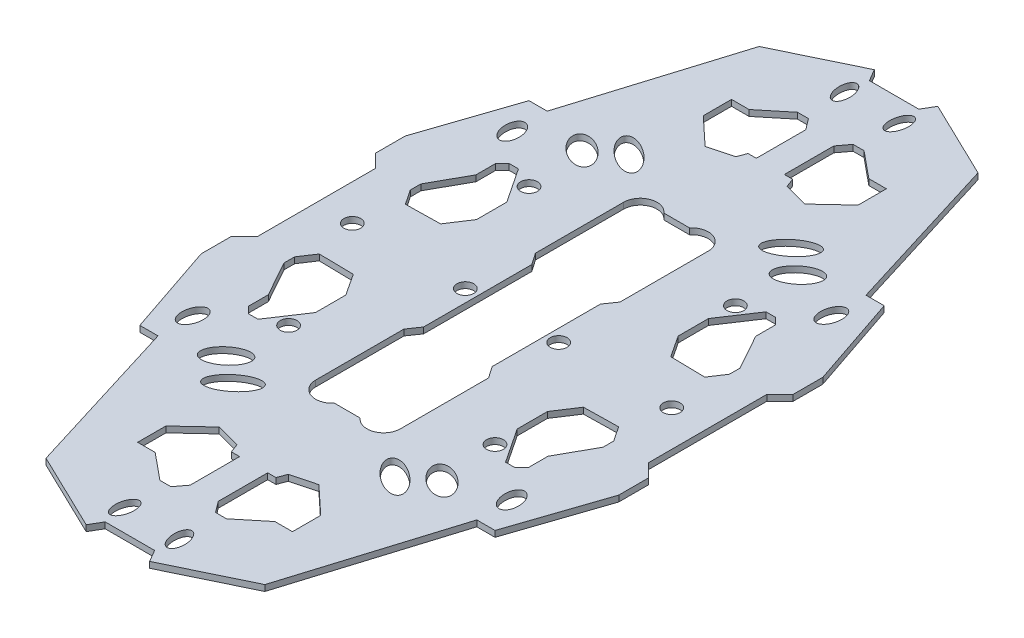
from build123d import *

# Parameters (mm, degrees)
BOSS_EXTRUDE1_DEPTH = 2.5
SKETCH8_R           = 3.5
CUT_EXTRUDE1_DEPTH  = 186.514646793


# Read off the part's stored shape, not the designer's step: Boss-Extrude1
with BuildPart() as part:
    # Boss-Extrude1 outline → Boss-Extrude1 (new body)
    with BuildSketch(Plane(origin=(0, 0, 0), x_dir=(1, 0, 0), z_dir=(0, 1, 0))):
        Polygon((-45.513137952, -148.299430721), (-13.199466787, -163.90034476), (-10.273563929, -158.926309901), (10.273563929, -158.926309901), (13.199466787, -163.90034476), (45.513137952, -148.299430721), (66.29043761, -80.933484761), (73.862243514, -80.933484761), (86.868355064, -42.439555474), (86.868355064, -30.071150974), (81.396454733, -24.599250643), (81.396454733, 24.599250643), (86.868355064, 30.071150974), (86.868355064, 42.439555474), (73.862243514, 80.933484761), (66.29043761, 80.933484761), (45.513137952, 148.299430721), (13.199466787, 163.90034476), (10.273563929, 158.926309901), (-10.273563929, 158.926309901), (-13.199466787, 163.90034476), (-45.513137952, 148.299430721), (-66.29043761, 80.933484761), (-73.862243514, 80.933484761), (-86.868355064, 42.439555474), (-86.868355064, 30.071150974), (-81.396454733, 24.599250643), (-81.396454733, -24.599250643), (-86.868355064, -30.071150974), (-86.868355064, -42.439555474), (-73.862243514, -80.933484761), (-66.29043761, -80.933484761), align=None)
        with BuildLine():
            add(Edge.make_bspline(
                [(-12.055306727, -155.270246002), (-6.888097383, -155.890311123), (-8.466427386, -147.202989655), (-10.044757389, -138.515668187), (-13.63363673, -146.582924534), (-17.222516071, -154.650180881), (-12.055306727, -155.270246002)],
                knots=[0, 0, 0, 2.094395102, 2.094395102, 4.188790205, 4.188790205, 6.283185307, 6.283185307, 6.283185307], degree=2, weights=[1, 0.5, 1, 0.5, 1, 0.5, 1]))
        make_face(mode=Mode.SUBTRACT)
        with BuildLine():
            add(Edge.make_bspline(
                [(-41.109644462, -88.389472789), (-36.381778622, -94.208384592), (-27.619928094, -82.259229639), (-18.858077566, -70.310074686), (-32.347793934, -76.440317836), (-45.837510302, -82.570560986), (-41.109644462, -88.389472789)],
                knots=[0, 0, 0, 2.094395102, 2.094395102, 4.188790205, 4.188790205, 6.283185307, 6.283185307, 6.283185307], degree=2, weights=[1, 0.5, 1, 0.5, 1, 0.5, 1]))
        make_face(mode=Mode.SUBTRACT)
        Polygon((-5.834875923, -107.44522339), (-5.834875923, -128.014628126), (-9.270194242, -132.585606956), (-13.841173073, -132.585606956), (-24.907753398, -123.503793754), (-32.198995676, -123.503793754), (-32.198995676, -111.76010755), (-20.757785776, -101.069910811), (-10.662983723, -103.716266976), (-9.270194242, -107.44522339), align=None, mode=Mode.SUBTRACT)
        with BuildLine():
            add(Edge.make_bspline(
                [(-67.147068225, -72.241634313), (-61.018671546, -73.078762277), (-62.895555816, -63.968179976), (-64.772440086, -54.857597675), (-69.023952495, -63.131052012), (-73.275464904, -71.404506348), (-67.147068225, -72.241634313)],
                knots=[0, 0, 0, 2.094395102, 2.094395102, 4.188790205, 4.188790205, 6.283185307, 6.283185307, 6.283185307], degree=2, weights=[1, 0.5, 1, 0.5, 1, 0.5, 1]))
        make_face(mode=Mode.SUBTRACT)
        with BuildLine():
            add(Edge.make_bspline(
                [(-51.486619053, -79.373952319), (-46.369881131, -85.671475916), (-39.041573506, -74.489789392), (-31.713265882, -63.308102868), (-44.158311429, -68.192265795), (-56.603356975, -73.076428723), (-51.486619053, -79.373952319)],
                knots=[0, 0, 0, 2.094395102, 2.094395102, 4.188790205, 4.188790205, 6.283185307, 6.283185307, 6.283185307], degree=2, weights=[1, 0.5, 1, 0.5, 1, 0.5, 1]))
        make_face(mode=Mode.SUBTRACT)
        Polygon((-47.849651346, -18.166894335), (-41.941351313, -27.187750764), (-41.941351313, -39.789061162), (-51.486619053, -54.160218526), (-55.402714886, -54.160218526), (-58.163676153, -51.399257259), (-58.163676153, -43.187167337), (-66.355525512, -28.46204058), (-66.355525512, -24.072820104), (-62.259600832, -17.90608076), align=None, mode=Mode.SUBTRACT)
        with BuildLine():
            add(Edge.make_bspline(
                [(12.055306727, -155.270246002), (6.888097383, -155.890311123), (8.466427386, -147.202989655), (10.044757389, -138.515668187), (13.63363673, -146.582924534), (17.222516071, -154.650180881), (12.055306727, -155.270246002)],
                knots=[0, 0, 0, 2.094395102, 2.094395102, 4.188790205, 4.188790205, 6.283185307, 6.283185307, 6.283185307], degree=2, weights=[1, 0.5, 1, 0.5, 1, 0.5, 1]))
        make_face(mode=Mode.SUBTRACT)
        Polygon((9.270194242, -132.585606956), (5.834875923, -128.014628126), (5.834875923, -107.44522339), (9.270194242, -107.44522339), (10.662983723, -103.716266976), (20.757785776, -101.069910811), (32.198995676, -111.76010755), (32.198995676, -123.503793754), (24.907753398, -123.503793754), (13.841173073, -132.585606956), align=None, mode=Mode.SUBTRACT)
        with BuildLine():
            add(Edge.make_bspline(
                [(41.109644462, -88.389472789), (36.381778622, -94.208384592), (27.619928094, -82.259229639), (18.858077566, -70.310074686), (32.347793934, -76.440317836), (45.837510302, -82.570560986), (41.109644462, -88.389472789)],
                knots=[0, 0, 0, 2.094395102, 2.094395102, 4.188790205, 4.188790205, 6.283185307, 6.283185307, 6.283185307], degree=2, weights=[1, 0.5, 1, 0.5, 1, 0.5, 1]))
        make_face(mode=Mode.SUBTRACT)
        with BuildLine():
            add(Edge.make_bspline(
                [(51.486619053, -79.373952319), (46.369881131, -85.671475916), (39.041573506, -74.489789392), (31.713265882, -63.308102868), (44.158311429, -68.192265795), (56.603356975, -73.076428723), (51.486619053, -79.373952319)],
                knots=[0, 0, 0, 2.094395102, 2.094395102, 4.188790205, 4.188790205, 6.283185307, 6.283185307, 6.283185307], degree=2, weights=[1, 0.5, 1, 0.5, 1, 0.5, 1]))
        make_face(mode=Mode.SUBTRACT)
        with BuildLine():
            add(Edge.make_bspline(
                [(67.147068225, -72.241634313), (61.018671546, -73.078762277), (62.895555816, -63.968179976), (64.772440086, -54.857597675), (69.023952495, -63.131052012), (73.275464904, -71.404506348), (67.147068225, -72.241634313)],
                knots=[0, 0, 0, 2.094395102, 2.094395102, 4.188790205, 4.188790205, 6.283185307, 6.283185307, 6.283185307], degree=2, weights=[1, 0.5, 1, 0.5, 1, 0.5, 1]))
        make_face(mode=Mode.SUBTRACT)
        Polygon((55.402714886, -54.160218526), (51.486619053, -54.160218526), (41.941351313, -39.789061162), (41.941351313, -27.187750764), (47.849651346, -18.166894335), (62.259600832, -17.90608076), (66.355525512, -24.072820104), (66.355525512, -28.46204058), (58.163676153, -43.187167337), (58.163676153, -51.399257259), align=None, mode=Mode.SUBTRACT)
        Polygon((-55.402714886, 54.160218526), (-51.486619053, 54.160218526), (-41.941351313, 39.789061162), (-41.941351313, 27.187750764), (-47.849651346, 18.166894335), (-62.259600832, 17.90608076), (-66.355525512, 24.072820104), (-66.355525512, 28.46204058), (-58.163676153, 43.187167337), (-58.163676153, 51.399257259), align=None, mode=Mode.SUBTRACT)
        with BuildLine():
            add(Edge.make_bspline(
                [(-67.147068225, 72.241634313), (-61.018671546, 73.078762277), (-62.895555816, 63.968179976), (-64.772440086, 54.857597675), (-69.023952495, 63.131052012), (-73.275464904, 71.404506348), (-67.147068225, 72.241634313)],
                knots=[0, 0, 0, 2.094395102, 2.094395102, 4.188790205, 4.188790205, 6.283185307, 6.283185307, 6.283185307], degree=2, weights=[1, 0.5, 1, 0.5, 1, 0.5, 1]))
        make_face(mode=Mode.SUBTRACT)
        with BuildLine():
            add(Edge.make_bspline(
                [(-51.486619053, 79.373952319), (-46.369881131, 85.671475916), (-39.041573506, 74.489789392), (-31.713265882, 63.308102868), (-44.158311429, 68.192265795), (-56.603356975, 73.076428723), (-51.486619053, 79.373952319)],
                knots=[0, 0, 0, 2.094395102, 2.094395102, 4.188790205, 4.188790205, 6.283185307, 6.283185307, 6.283185307], degree=2, weights=[1, 0.5, 1, 0.5, 1, 0.5, 1]))
        make_face(mode=Mode.SUBTRACT)
        with BuildLine():
            add(Edge.make_bspline(
                [(-41.109644462, 88.389472789), (-36.381778622, 94.208384592), (-27.619928094, 82.259229639), (-18.858077566, 70.310074686), (-32.347793934, 76.440317836), (-45.837510302, 82.570560986), (-41.109644462, 88.389472789)],
                knots=[0, 0, 0, 2.094395102, 2.094395102, 4.188790205, 4.188790205, 6.283185307, 6.283185307, 6.283185307], degree=2, weights=[1, 0.5, 1, 0.5, 1, 0.5, 1]))
        make_face(mode=Mode.SUBTRACT)
        Polygon((-9.270194242, 132.585606956), (-5.834875923, 128.014628126), (-5.834875923, 107.44522339), (-9.270194242, 107.44522339), (-10.662983723, 103.716266976), (-20.757785776, 101.069910811), (-32.198995676, 111.76010755), (-32.198995676, 123.503793754), (-24.907753398, 123.503793754), (-13.841173073, 132.585606956), align=None, mode=Mode.SUBTRACT)
        with BuildLine():
            add(Edge.make_bspline(
                [(-12.055306727, 155.270246002), (-6.888097383, 155.890311123), (-8.466427386, 147.202989655), (-10.044757389, 138.515668187), (-13.63363673, 146.582924534), (-17.222516071, 154.650180881), (-12.055306727, 155.270246002)],
                knots=[0, 0, 0, 2.094395102, 2.094395102, 4.188790205, 4.188790205, 6.283185307, 6.283185307, 6.283185307], degree=2, weights=[1, 0.5, 1, 0.5, 1, 0.5, 1]))
        make_face(mode=Mode.SUBTRACT)
        with BuildLine():
            ThreePointArc((17.600819084, -64.024331642), (13.039673653, -70.554486626), (5.345717729, -68.492930418))
            Line((5.345717729, -68.492930418), (-5.345717729, -68.492930418))
            ThreePointArc((-5.345717729, -68.492930418), (-13.039673653, -70.554486626), (-17.600819084, -64.024331642))
            Line((-17.600819084, -64.024331642), (-17.600819084, -27.344801488))
            Line((-17.600819084, -27.344801488), (-14.264554689, -22.498047837))
            Line((-14.264554689, -22.498047837), (-14.264554689, 22.498047837))
            Line((-14.264554689, 22.498047837), (-17.600819084, 27.344801488))
            Line((-17.600819084, 27.344801488), (-17.600819084, 64.024331642))
            ThreePointArc((-17.600819084, 64.024331642), (-13.039673653, 70.554486626), (-5.345717729, 68.492930418))
            Line((-5.345717729, 68.492930418), (5.345717729, 68.492930418))
            ThreePointArc((5.345717729, 68.492930418), (13.039673653, 70.554486626), (17.600819084, 64.024331642))
            Line((17.600819084, 64.024331642), (17.600819084, 27.344801488))
            Line((17.600819084, 27.344801488), (14.264554689, 22.498047837))
            Line((14.264554689, 22.498047837), (14.264554689, -22.498047837))
            Line((14.264554689, -22.498047837), (17.600819084, -27.344801488))
            Line((17.600819084, -27.344801488), (17.600819084, -64.024331642))
        make_face(mode=Mode.SUBTRACT)
        Polygon((47.849651346, 18.166894335), (41.941351313, 27.187750764), (41.941351313, 39.789061162), (51.486619053, 54.160218526), (55.402714886, 54.160218526), (58.163676153, 51.399257259), (58.163676153, 43.187167337), (66.355525512, 28.46204058), (66.355525512, 24.072820104), (62.259600832, 17.90608076), align=None, mode=Mode.SUBTRACT)
        with BuildLine():
            add(Edge.make_bspline(
                [(51.486619053, 79.373952319), (46.369881131, 85.671475916), (39.041573506, 74.489789392), (31.713265882, 63.308102868), (44.158311429, 68.192265795), (56.603356975, 73.076428723), (51.486619053, 79.373952319)],
                knots=[0, 0, 0, 2.094395102, 2.094395102, 4.188790205, 4.188790205, 6.283185307, 6.283185307, 6.283185307], degree=2, weights=[1, 0.5, 1, 0.5, 1, 0.5, 1]))
        make_face(mode=Mode.SUBTRACT)
        with BuildLine():
            add(Edge.make_bspline(
                [(67.147068225, 72.241634313), (61.018671546, 73.078762277), (62.895555816, 63.968179976), (64.772440086, 54.857597675), (69.023952495, 63.131052012), (73.275464904, 71.404506348), (67.147068225, 72.241634313)],
                knots=[0, 0, 0, 2.094395102, 2.094395102, 4.188790205, 4.188790205, 6.283185307, 6.283185307, 6.283185307], degree=2, weights=[1, 0.5, 1, 0.5, 1, 0.5, 1]))
        make_face(mode=Mode.SUBTRACT)
        Polygon((5.834875923, 107.44522339), (5.834875923, 128.014628126), (9.270194242, 132.585606956), (13.841173073, 132.585606956), (24.907753398, 123.503793754), (32.198995676, 123.503793754), (32.198995676, 111.76010755), (20.757785776, 101.069910811), (10.662983723, 103.716266976), (9.270194242, 107.44522339), align=None, mode=Mode.SUBTRACT)
        with BuildLine():
            add(Edge.make_bspline(
                [(41.109644462, 88.389472789), (36.381778622, 94.208384592), (27.619928094, 82.259229639), (18.858077566, 70.310074686), (32.347793934, 76.440317836), (45.837510302, 82.570560986), (41.109644462, 88.389472789)],
                knots=[0, 0, 0, 2.094395102, 2.094395102, 4.188790205, 4.188790205, 6.283185307, 6.283185307, 6.283185307], degree=2, weights=[1, 0.5, 1, 0.5, 1, 0.5, 1]))
        make_face(mode=Mode.SUBTRACT)
        with BuildLine():
            add(Edge.make_bspline(
                [(12.055306727, 155.270246002), (6.888097383, 155.890311123), (8.466427386, 147.202989655), (10.044757389, 138.515668187), (13.63363673, 146.582924534), (17.222516071, 154.650180881), (12.055306727, 155.270246002)],
                knots=[0, 0, 0, 2.094395102, 2.094395102, 4.188790205, 4.188790205, 6.283185307, 6.283185307, 6.283185307], degree=2, weights=[1, 0.5, 1, 0.5, 1, 0.5, 1]))
        make_face(mode=Mode.SUBTRACT)
    extrude(amount=BOSS_EXTRUDE1_DEPTH)

    # Sketch8 → Cut-Extrude1 (cut, through all)
    with BuildSketch(Plane(origin=(0, 2.5, 0), x_dir=(1, 0, 0), z_dir=(0, 1, 0))):
        with Locations(Location((42.910681545, 50, 0), (0, 0, 270))):
            Circle(SKETCH8_R)
        with Locations(Location((19.410681545, 0, 0), (0, 0, 270))):
            Circle(SKETCH8_R)
        with Locations(Location((66.410681545, 0, 0), (0, 0, 90))):
            Circle(SKETCH8_R)
        with Locations(Location((42.910681545, -50, 0), (0, 0, 90))):
            Circle(SKETCH8_R)
        with Locations(Location((-42.910681545, -50, 0), (0, 0, 270))):
            Circle(SKETCH8_R)
        with Locations(Location((-66.410681545, 0, 0), (0, 0, 270))):
            Circle(SKETCH8_R)
        with Locations(Location((-19.410681545, 0, 0), (0, 0, 90))):
            Circle(SKETCH8_R)
        with Locations(Location((-42.910681545, 50, 0), (0, 0, 90))):
            Circle(SKETCH8_R)
    extrude(amount=-CUT_EXTRUDE1_DEPTH, mode=Mode.SUBTRACT)


solid = part.part
